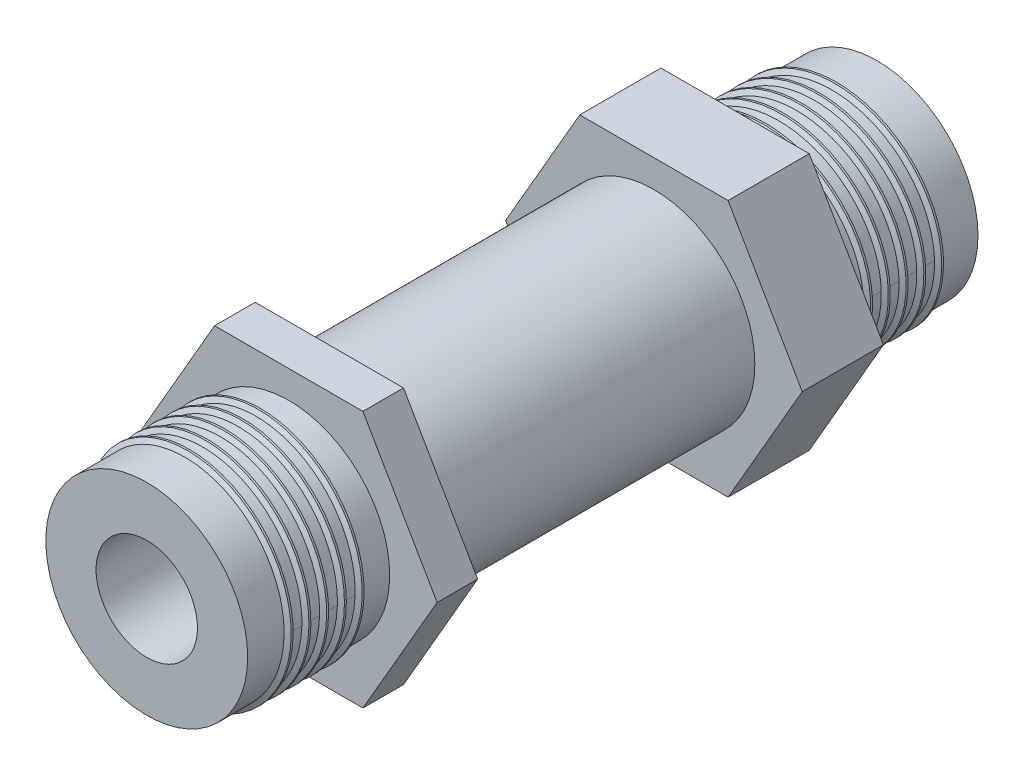
from build123d import *

# Parameters (mm, degrees)
BASE_INNER_DIA_R      = 9.95
BASE_INNER_DIA_R_2    = 5
INNER_CYC_DEPTH       = 14
THREAD_PITCH          = 1.75
THREAD_HEIGHT         = 8.75
THREAD_RADIUS         = 9.95
THREAD_START_ANGLE    = -90
BOSS_EXTRUDE1_DEPTH   = 4
MIRROR3_START         = 36
MIRROR3_OUTLINE_R     = 9.95
MIRROR3_OUTLINE_R_2   = 5
MIRROR3_DEPTH         = 36
MIRROR3_START_2       = 54
MIRROR3_2_OUTLINE_R   = 9.95
MIRROR3_2_OUTLINE_R_2 = 5
MIRROR3_2_DEPTH       = 4
INNER_CUT_DEPTH       = 54.612236181
INNER_CUT_DEPTH_BACK  = 54.612236181
SKETCH2_R             = 5


# Read off the part's stored shape, not the designer's step: Mirror3
with BuildPart() as part:
    # base-inner-dia → inner-cyc (new body)
    with BuildSketch(Plane.XY):
        Circle(BASE_INNER_DIA_R)
        Circle(BASE_INNER_DIA_R_2, mode=Mode.SUBTRACT)
    inner_cyc = extrude(amount=INNER_CYC_DEPTH)

    # thread: sweep along a helix
    with BuildLine() as thread_path:
        add(Helix(THREAD_PITCH, THREAD_HEIGHT, THREAD_RADIUS, center=(0, 0, 12.25), direction=(0, 0, -1), mode=Mode.PRIVATE).rotate(Axis((0, 0, 12.25), (0, 0, -1)), THREAD_START_ANGLE))
    # extrude 2 → thread (sweep)
    with BuildSketch(Plane(origin=(0, 0, 0), x_dir=(0, 0, -1), z_dir=(1, 0, 0))):
        Polygon((-12.345, -10.392184185), (-12.155, -10.392184185), (-11.843230855, -9.852184185), (-12.656769145, -9.852184185), align=None)
    thread = sweep(path=thread_path.line, is_frenet=True)

    # hex bottom → Boss-Extrude1 (add)
    with BuildSketch(Plane.XY.offset(14)):
        Polygon((0, -12.665), (-7.312141159, -12.665), (-14.624282319, 0), (-7.312141159, 12.665), (0, 12.665), (7.312141159, 12.665), (14.624282319, 0), (7.312141159, -12.665), align=None)
    boss_extrude1 = extrude(amount=BOSS_EXTRUDE1_DEPTH)

    # Mirror1: Boss-Extrude1 across plane
    add(boss_extrude1.mirror(Plane.XY.offset(18)))

    # Mirror2: inner-cyc across plane
    add(inner_cyc.mirror(Plane.XY.offset(18)))

    # Mirror3 outline → Mirror3 (add)
    with BuildSketch(Plane.XY.offset(MIRROR3_START)):
        Circle(MIRROR3_OUTLINE_R)
        Circle(MIRROR3_OUTLINE_R_2, mode=Mode.SUBTRACT)
    extrude(amount=MIRROR3_DEPTH)

    # Mirror3 2 outline → Mirror3 2 (add)
    # profile 1 of 2: a face of its own
    with BuildSketch(Plane.XY.offset(MIRROR3_START_2)):
        Polygon((-7.312141159, -12.665), (7.312141159, -12.665), (14.624282319, 0), (7.312141159, 12.665), (-7.312141159, 12.665), (-14.624282319, 0), align=None)
        Circle(MIRROR3_2_OUTLINE_R, mode=Mode.SUBTRACT)
    # profile 2 of 2: a face of its own
    with BuildSketch(Plane.XY.offset(MIRROR3_START_2)):
        Circle(MIRROR3_2_OUTLINE_R_2)
    extrude(amount=MIRROR3_2_DEPTH)

    # Mirror4: thread across plane
    add(thread.mirror(Plane.XY.offset(36)))

    # Sketch2 → inner-cut (cut, two sides: drawn at the far end of the back side and taken through both)
    with BuildSketch(Plane.XY.offset(22).offset(-INNER_CUT_DEPTH_BACK)):
        Circle(SKETCH2_R)
    extrude(amount=INNER_CUT_DEPTH + INNER_CUT_DEPTH_BACK, mode=Mode.SUBTRACT)


solid = part.part
